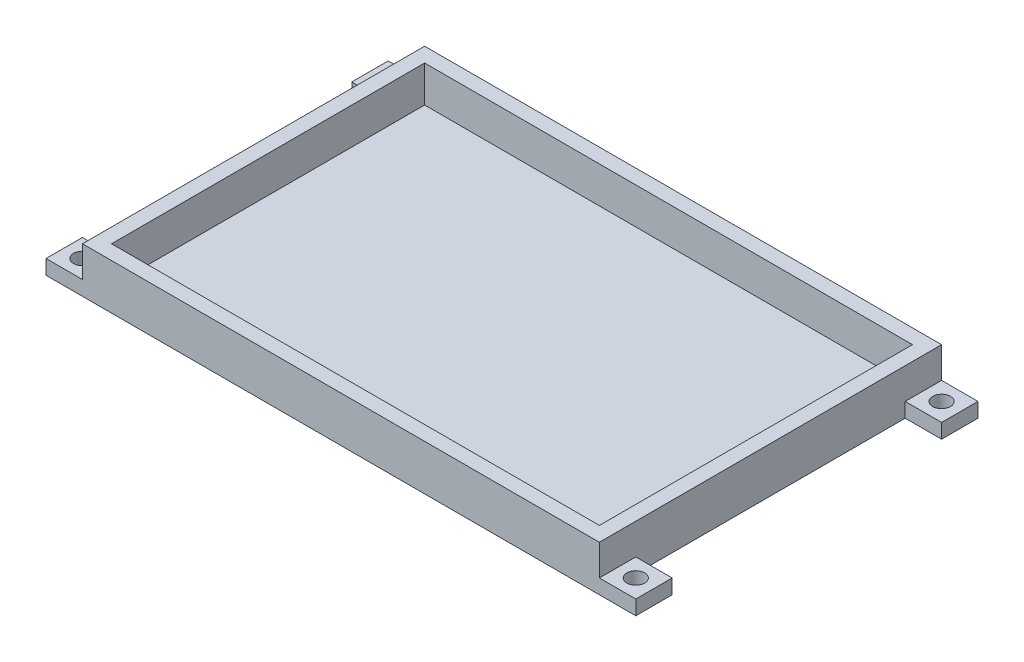
from build123d import *

# Parameters (mm, degrees)
SKETCH1_W           = 90.17
SKETCH1_H           = 59.69
SKETCH1_W_2         = 85.09
SKETCH1_H_2         = 54.61
BOSS_EXTRUDE1_DEPTH = 6.35
SKETCH2_W           = 90.17
SKETCH2_H           = 59.69
BOSS_EXTRUDE2_DEPTH = 1.5875
SKETCH3_W           = 6.35
SKETCH3_H           = 6.35
SKETCH3_R           = 1.55
BOSS_EXTRUDE3_DEPTH = 2.54


with BuildPart() as part:
    # Sketch1 → Boss-Extrude1 (new body)
    with BuildSketch(Plane(origin=(0, 0, 0), x_dir=(1, 0, 0), z_dir=(0, 1, 0))):
        with Locations((42.545, 27.305)):
            Rectangle(SKETCH1_W, SKETCH1_H)
        with Locations((42.545, 27.305)):
            Rectangle(SKETCH1_W_2, SKETCH1_H_2, mode=Mode.SUBTRACT)
    extrude(amount=BOSS_EXTRUDE1_DEPTH)

    # Sketch2 → Boss-Extrude2 (add)
    with BuildSketch(Plane.XZ):
        with Locations((42.545, -27.305)):
            Rectangle(SKETCH2_W, SKETCH2_H)
    extrude(amount=BOSS_EXTRUDE2_DEPTH)

    # Sketch3 → Boss-Extrude3 (add)
    # profile 1 of 4: a face of its own
    with BuildSketch(Plane.XZ.offset(1.5875)):
        with Locations((90.805, -53.975)):
            Rectangle(SKETCH3_W, SKETCH3_H)
        with Locations((90.805, -53.975)):
            Circle(SKETCH3_R, mode=Mode.SUBTRACT)
    # profile 2 of 4: a face of its own
    with BuildSketch(Plane.XZ.offset(1.5875)):
        with Locations((90.805, -0.635)):
            Rectangle(SKETCH3_W, SKETCH3_H)
        with Locations((90.805, -0.635)):
            Circle(SKETCH3_R, mode=Mode.SUBTRACT)
    # profile 3 of 4: a face of its own
    with BuildSketch(Plane.XZ.offset(1.5875)):
        with Locations((-5.715, -53.975)):
            Rectangle(SKETCH3_W, SKETCH3_H)
        with Locations((-5.715, -53.975)):
            Circle(SKETCH3_R, mode=Mode.SUBTRACT)
    # profile 4 of 4: a face of its own
    with BuildSketch(Plane.XZ.offset(1.5875)):
        with Locations((-5.715, -0.635)):
            Rectangle(SKETCH3_W, SKETCH3_H)
        with Locations((-5.715, -0.635)):
            Circle(SKETCH3_R, mode=Mode.SUBTRACT)
    extrude(amount=-BOSS_EXTRUDE3_DEPTH)


solid = part.part
